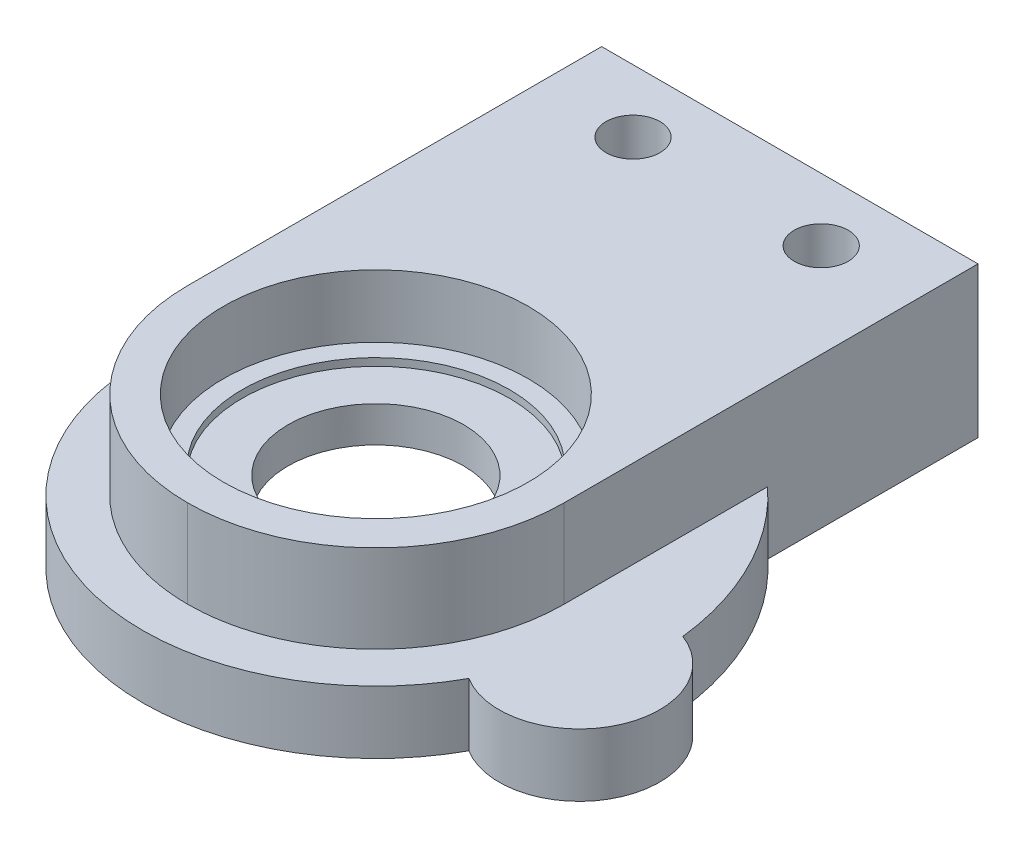
from build123d import *

# Parameters (mm, degrees)
EXTRUDE_873_DEPTH      = 48
FILLET_1_R             = 15
SKETCH_2533_R          = 1
EXTRUDE_4839_DEPTH     = 5
SKETCH_1_4_R           = 15.75
CUT_EXTRUDE_5054_DEPTH = 3.55
SKETCH_1_5_R           = 2.15
SKETCH_1_5_R_2         = 7
CUT_EXTRUDE_5752_DEPTH = 12
SKETCH_5896_R          = 12.15
SKETCH_5896_R_2        = 10.65
CUT_EXTRUDE_6261_DEPTH = 5
SKETCH_2_3_R           = 10.65
CUT_EXTRUDE_6307_DEPTH = 5.6
SKETCH_7_R             = 2.15
SKETCH_7_R_2           = 3.65
CUT_EXTRUDE_6391_DEPTH = 5


with BuildPart() as part:
    # Sketch 353 → Extrude 873 (new body)
    with BuildSketch(Plane.XY):
        Polygon((-1e-08, 3.5), (-15, 3.5), (-15, -6), (15, -6), (15, 3.5), align=None)
        with BuildLine():
            Line((-15, 6), (-15, 3.5))
            Line((-15, 3.5), (-1e-08, 3.5))
            ThreePointArc((-1e-08, 3.5), (-4.330127024, 4.138593385), (-8.291561976, 6))
            Line((-8.291561976, 6), (-15, 6))
        make_face()
        with BuildLine():
            ThreePointArc((-8.291561976, 6), (-4.330127024, 4.138593385), (-1e-08, 3.5))
            ThreePointArc((-1e-08, 3.5), (4.330127014, 4.138593382), (8.291561976, 6))
            Line((8.291561976, 6), (-8.291561976, 6))
        make_face()
        with BuildLine():
            ThreePointArc((8.291561976, 6), (4.330127014, 4.138593382), (-1e-08, 3.5))
            Line((-1e-08, 3.5), (15, 3.5))
            Line((15, 3.5), (15, 6))
            Line((15, 6), (8.291561976, 6))
        make_face()
    extrude(amount=EXTRUDE_873_DEPTH)

    # Скругление1
    fillet_1_edges = [part.edges().sort_by_distance(p)[0] for p in [
        (-15, 0, 48),
        (15, 0, 48),
    ]]
    fillet(fillet_1_edges, radius=FILLET_1_R - 0.0001)  # a hair under: the kernel refuses the full size


with BuildPart() as body_2:
    # Sketch 2533 → Extrude 4839 (new body)
    # profile 1 of 5: a face of its own
    with BuildSketch(Plane.XZ.offset(6)):
        with BuildLine():
            Line((-15, 22.001818332), (-15, 23.793480571))
            ThreePointArc((-15, 23.793480571), (-8.310689955, 48.514265451), (15.975091459, 40.386234011))
            ThreePointArc((15.975091459, 40.386234011), (24.423228184, 39.083476852), (21.026417078, 31.239379412))
            ThreePointArc((21.026417078, 31.239379412), (19.163501403, 24.169925597), (15, 18.160525616))
            Line((15, 18.160525616), (15, 16.770089341))
            ThreePointArc((15, 16.770089341), (19.709709926, 23.003133759), (21.956474455, 30.485396749))
            ThreePointArc((21.956474455, 30.485396749), (25.437011886, 39.301843704), (16.325243686, 41.913272047))
            ThreePointArc((16.325243686, 41.913272047), (-9.977753503, 48.697274764), (-15, 22.001818332))
        make_face()
    # profile 2 of 5: a face of its own
    with BuildSketch(Plane.XZ.offset(6)):
        with BuildLine():
            Line((-15, 23.793480571), (-15, 28.197656822))
            ThreePointArc((-15, 28.197656822), (-2.430277762, 48.561370441), (15.75, 33))
            ThreePointArc((15.75, 33), (15.561370441, 30.569722238), (15, 28.197656822))
            Line((15, 28.197656822), (15, 18.160525616))
            ThreePointArc((15, 18.160525616), (19.163501403, 24.169925597), (21.026417078, 31.239379412))
            ThreePointArc((21.026417078, 31.239379412), (24.423228184, 39.083476852), (15.975091459, 40.386234011))
            ThreePointArc((15.975091459, 40.386234011), (-8.310689955, 48.514265451), (-15, 23.793480571))
        make_face()
        with BuildLine():
            ThreePointArc((18.566239786, 34.242875781), (16.249327925, 35.865194932), (17.871647075, 38.182106793))
            Line((17.871647075, 38.182106793), (20.826070334, 38.703051326))
            ThreePointArc((20.826070334, 38.703051326), (23.142982196, 37.080732175), (21.520663045, 34.763820314))
            Line((21.520663045, 34.763820314), (18.566239786, 34.242875781))
        make_face(mode=Mode.SUBTRACT)
    # profile 3 of 5: a face of its own
    with BuildSketch(Plane.XZ.offset(6)):
        with BuildLine():
            ThreePointArc((20.826070334, 38.703051326), (23.142982196, 37.080732175), (21.520663045, 34.763820314))
            Line((21.520663045, 34.763820314), (18.566239786, 34.242875781))
            ThreePointArc((18.566239786, 34.242875781), (16.249327925, 35.865194932), (17.871647075, 38.182106793))
            Line((17.871647075, 38.182106793), (20.826070334, 38.703051326))
        make_face()
        with Locations((19.69615506, 36.472963553)):
            Circle(SKETCH_2533_R, mode=Mode.SUBTRACT)
    # profile 4 of 5: a face of its own
    with BuildSketch(Plane.XZ.offset(6)):
        with BuildLine():
            Line((-15, 28.197656822), (-15, 33))
            ThreePointArc((-15, 33), (-10.606601718, 43.606601718), (0, 48))
            ThreePointArc((0, 48), (10.606601718, 43.606601718), (15, 33))
            Line((15, 33), (15, 28.197656822))
            ThreePointArc((15, 28.197656822), (15.561370441, 30.569722238), (15.75, 33))
            ThreePointArc((15.75, 33), (-2.430277762, 48.561370441), (-15, 28.197656822))
        make_face()
    # profile 5 of 5: a face of its own
    with BuildSketch(Plane.XZ.offset(6)):
        with Locations((19.69615506, 36.472963553)):
            Circle(SKETCH_2533_R)
    extrude(amount=-EXTRUDE_4839_DEPTH)


with BuildPart() as cut_extrude_5054_tool:
    # Эскиз1<4> → Cut-Extrude 5054 (new body)
    with BuildSketch(Plane.XZ.offset(6)):
        with Locations((0, 33)):
            Circle(SKETCH_1_4_R)
    extrude(amount=-CUT_EXTRUDE_5054_DEPTH)


with BuildPart() as part_1:
    add(part.part)

    # Cut-Extrude 5054: cut by cut_extrude_5054_tool
    add(cut_extrude_5054_tool.part, mode=Mode.SUBTRACT)

    # Sketch 1_5 → Cut-Extrude 5752 (cut)
    with BuildSketch(Plane.XZ.offset(6)):
        with Locations(Location((7.5, 5, 0), (0, 0, 270))):
            Circle(SKETCH_1_5_R)
        with Locations(Location((-7.5, 5, 0), (0, 0, 270))):
            Circle(SKETCH_1_5_R)
        with Locations(Location((0, 33, 0), (0, 0, 270))):
            Circle(SKETCH_1_5_R_2)
    extrude(amount=-CUT_EXTRUDE_5752_DEPTH, mode=Mode.SUBTRACT)

    # Sketch 5896 → Cut-Extrude 6261 (cut)
    with BuildSketch(Plane(origin=(0, 6, 0), x_dir=(1, 0, 0), z_dir=(0, 1, 0))):
        with Locations(Location((0, -33, 0), (0, 0, 270))):
            Circle(SKETCH_5896_R)
        with Locations(Location((0, -33, 0), (0, 0, 270))):
            Circle(SKETCH_5896_R_2, mode=Mode.SUBTRACT)
    extrude(amount=-CUT_EXTRUDE_6261_DEPTH, mode=Mode.SUBTRACT)

    # Sketch 2_3 → Cut-Extrude 6307 (cut)
    with BuildSketch(Plane(origin=(0, 6, 0), x_dir=(1, 0, 0), z_dir=(0, 1, 0))):
        with Locations(Location((0, -33, 0), (0, 0, 270))):
            Circle(SKETCH_2_3_R)
    extrude(amount=-CUT_EXTRUDE_6307_DEPTH, mode=Mode.SUBTRACT)

    # Эскиз под резистор<7> → Cut-Extrude 6391 (cut)
    # profile 1 of 3: a face of its own
    with BuildSketch(Plane.XZ.offset(6)):
        with BuildLine():
            ThreePointArc((-6.250710878, 8.429544677), (-7.551544535, 8.271665699), (-8.856706058, 8.388487667))
            ThreePointArc((-8.856706058, 8.388487667), (-9.545791154, 1.977213445), (-3.85, 5))
            ThreePointArc((-3.85, 5), (-4.509815617, 7.09315488), (-6.250710878, 8.429544677))
        make_face()
        with Locations(Location((-7.5, 5, 0), (0, 0, 270))):
            Circle(SKETCH_7_R, mode=Mode.SUBTRACT)
    # profile 2 of 3: a face of its own
    with BuildSketch(Plane.XZ.offset(6)):
        with BuildLine():
            ThreePointArc((-6.250710878, 8.429544677), (-7.557497992, 8.649547093), (-8.856706058, 8.388487667))
            ThreePointArc((-8.856706058, 8.388487667), (-7.551544535, 8.271665699), (-6.250710878, 8.429544677))
        make_face()
    # profile 3 of 3: a face of its own
    with BuildSketch(Plane.XZ.offset(6)):
        with Locations(Location((7.5, 5, 0), (0, 0, 270))):
            Circle(SKETCH_7_R_2)
        with Locations(Location((7.5, 5, 0), (0, 0, 270))):
            Circle(SKETCH_7_R, mode=Mode.SUBTRACT)
    extrude(amount=-CUT_EXTRUDE_6391_DEPTH, mode=Mode.SUBTRACT)


with BuildPart() as body_2_1:
    add(body_2.part)

    # Cut-Extrude 5054: cut by cut_extrude_5054_tool
    add(cut_extrude_5054_tool.part, mode=Mode.SUBTRACT)


solid = Compound([part_1.part, body_2_1.part])
